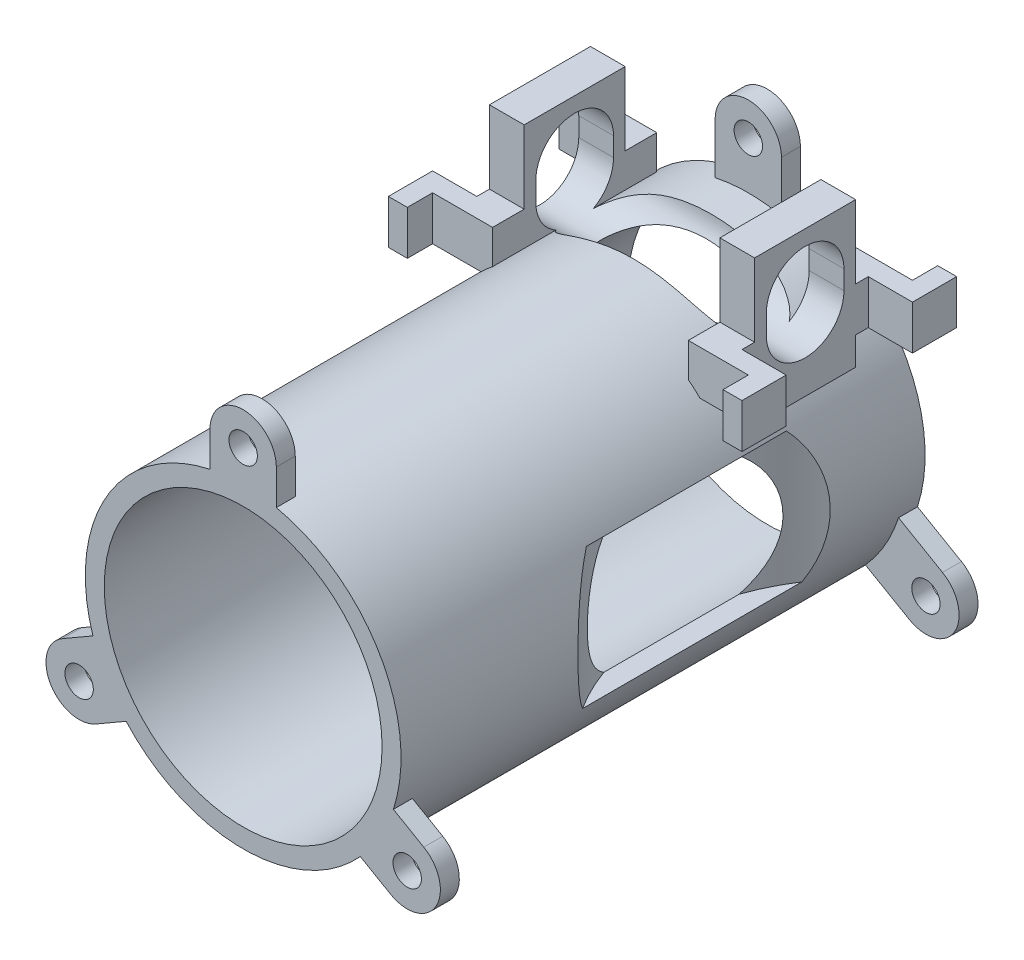
from build123d import *

# Parameters (mm, degrees)
SKETCH1_R            = 25
SKETCH1_R_2          = 22
BOSS_EXTRUDE1_DEPTH  = 30
SKETCH3_R            = 6.15
CUT_EXTRUDE1_DEPTH   = 25
SKETCH7_R            = 25
SKETCH7_R_2          = 22
BOSS_EXTRUDE4_DEPTH  = 53
SKETCH9_R            = 2.25
BOSS_EXTRUDE5_DEPTH  = 3
CIRPATTERN1_COUNT    = 3
BOSS_EXTRUDE6_START  = -3
SKETCH10_R           = 2.25
BOSS_EXTRUDE6_DEPTH  = 3
CIRPATTERN2_COUNT    = 3
BOSS_EXTRUDE7_DEPTH  = 8
CUT_EXTRUDE5_START   = -16
CUT_EXTRUDE5_DEPTH   = 16
BOSS_EXTRUDE8_DEPTH  = 7
MIRROR2_COPY_1_DEPTH = 7
SKETCH12_R           = 32
CUT_EXTRUDE4_DEPTH   = 21


with BuildPart() as part:
    # Sketch1 → Boss-Extrude1 (new body)
    with BuildSketch(Plane.XY):
        Circle(SKETCH1_R)
        Circle(SKETCH1_R_2, mode=Mode.SUBTRACT)
    extrude(amount=BOSS_EXTRUDE1_DEPTH)

    # Sketch3 → Cut-Extrude1 (cut, symmetric)
    with BuildSketch(Plane(origin=(0, 0, 0), x_dir=(0, 0, -1), z_dir=(1, 0, 0))):
        with Locations((-15, 25)):
            Circle(SKETCH3_R)
    extrude(amount=CUT_EXTRUDE1_DEPTH, both=True, mode=Mode.SUBTRACT)

    # Sketch7 → Boss-Extrude4 (add)
    with BuildSketch(Plane.XY.offset(30)):
        Circle(SKETCH7_R)
        Circle(SKETCH7_R_2, mode=Mode.SUBTRACT)
    extrude(amount=BOSS_EXTRUDE4_DEPTH)

    # Sketch9 → Boss-Extrude5 (add)
    with BuildSketch(Plane(origin=(0, 0, 0), x_dir=(-1, 0, 0), z_dir=(0, 0, -1))):
        with BuildLine():
            Line((5.25, 24.442534648), (5.25, 32.484665375))
            ThreePointArc((5.25, 32.484665375), (0, 37.734665375), (-5.25, 32.484665375))
            Line((-5.25, 32.484665375), (-5.25, 24.442534648))
            ThreePointArc((-5.25, 24.442534648), (0, 25), (5.25, 24.442534648))
        make_face()
        with Locations((0, 32.484665375)):
            Circle(SKETCH9_R, mode=Mode.SUBTRACT)
    boss_extrude5 = extrude(amount=-BOSS_EXTRUDE5_DEPTH)

    # CirPattern1: Boss-Extrude5 ×3 about axis
    cirpattern1_axis = Axis((0, 0, 0), (0, 0, 1))
    for i in range(1, CIRPATTERN1_COUNT):
        add(boss_extrude5.rotate(cirpattern1_axis, i * 360 / CIRPATTERN1_COUNT))

    # Sketch10 → Boss-Extrude6 (add)
    with BuildSketch(Plane.XY.offset(83).offset(BOSS_EXTRUDE6_START)):
        with BuildLine():
            ThreePointArc((-5.25, 24.442534648), (0, 25), (5.25, 24.442534648))
            Line((5.25, 24.442534648), (5.25, 30))
            ThreePointArc((5.25, 30), (0, 35.25), (-5.25, 30))
            Line((-5.25, 30), (-5.25, 24.442534648))
        make_face()
        with Locations((0, 30)):
            Circle(SKETCH10_R, mode=Mode.SUBTRACT)
    boss_extrude6 = extrude(amount=BOSS_EXTRUDE6_DEPTH)

    # CirPattern2: Boss-Extrude6 ×3 about axis
    cirpattern2_axis = Axis((0, 0, 83), (0, 0, 1))
    for i in range(1, CIRPATTERN2_COUNT):
        add(boss_extrude6.rotate(cirpattern2_axis, i * 360 / CIRPATTERN2_COUNT))

    # Sketch14 → Boss-Extrude7 (add, symmetric)
    with BuildSketch(Plane.XY.offset(15)):
        with BuildLine():
            Line((-21, 13.564659966), (-21, 36.564659966))
            Line((-21, 36.564659966), (-15.5, 36.564659966))
            Line((-15.5, 36.564659966), (-15.5, 19.615045246))
            ThreePointArc((-15.5, 19.615045246), (-18.499034853, 16.816233511), (-21, 13.564659966))
        make_face()
    boss_extrude7 = extrude(amount=BOSS_EXTRUDE7_DEPTH, both=True)

    # Sketch15 → Cut-Extrude5 (cut)
    with BuildSketch(Plane.ZY.offset(21).offset(CUT_EXTRUDE5_START)):
        with BuildLine():
            Line((8.85, 25), (8.85, 28))
            ThreePointArc((8.85, 28), (15, 34.15), (21.15, 28))
            Line((21.15, 28), (21.15, 25))
            ThreePointArc((21.15, 25), (15, 18.85), (8.85, 25))
        make_face()
    cut_extrude5 = extrude(amount=CUT_EXTRUDE5_DEPTH, mode=Mode.SUBTRACT)

    # Sketch17 → Boss-Extrude8 (add)
    with BuildSketch(Plane(origin=(0, 25, 0), x_dir=(1, 0, 0), z_dir=(0, 1, 0))):
        Polygon((-15.5, -23), (-21, -23), (-21, -25), (-28, -25), (-28, -32), (-25, -32), (-25, -28), (-15.5, -28), align=None)
    boss_extrude8 = extrude(amount=-BOSS_EXTRUDE8_DEPTH)

    # Mirror1: Boss-Extrude8 across plane
    add(boss_extrude8.mirror(Plane.XY.offset(15)))

    # Mirror2: Boss-Extrude7, Cut-Extrude5, Boss-Extrude8 across plane
    add(boss_extrude7.mirror(Plane(origin=(0, 0, 0), x_dir=(0, 0, 1), z_dir=(1, 0, 0))))
    add(cut_extrude5.mirror(Plane(origin=(0, 0, 0), x_dir=(0, 0, 1), z_dir=(1, 0, 0))), mode=Mode.SUBTRACT)
    add(boss_extrude8.mirror(Plane(origin=(0, 0, 0), x_dir=(0, 0, 1), z_dir=(1, 0, 0))))

    # Mirror2 copy 1 sketch → Mirror2 copy 1 (add)
    with BuildSketch(Plane(origin=(0, 25, 30), x_dir=(-1, 0, 0), z_dir=(0, 1, 0))):
        Polygon((-15.5, -23), (-21, -23), (-21, -25), (-28, -25), (-28, -32), (-25, -32), (-25, -28), (-15.5, -28), align=None)
    extrude(amount=-MIRROR2_COPY_1_DEPTH)

    # Sketch12 → Cut-Extrude4 (cut)
    with BuildSketch(Plane(origin=(0, 11.51, 0), x_dir=(1, 0, 0), z_dir=(0, 1, 0))):
        with Locations((-50, -35)):
            Circle(SKETCH12_R)
        with Locations((50, -35)):
            Circle(SKETCH12_R)
    extrude(amount=-CUT_EXTRUDE4_DEPTH, mode=Mode.SUBTRACT)


solid = part.part
